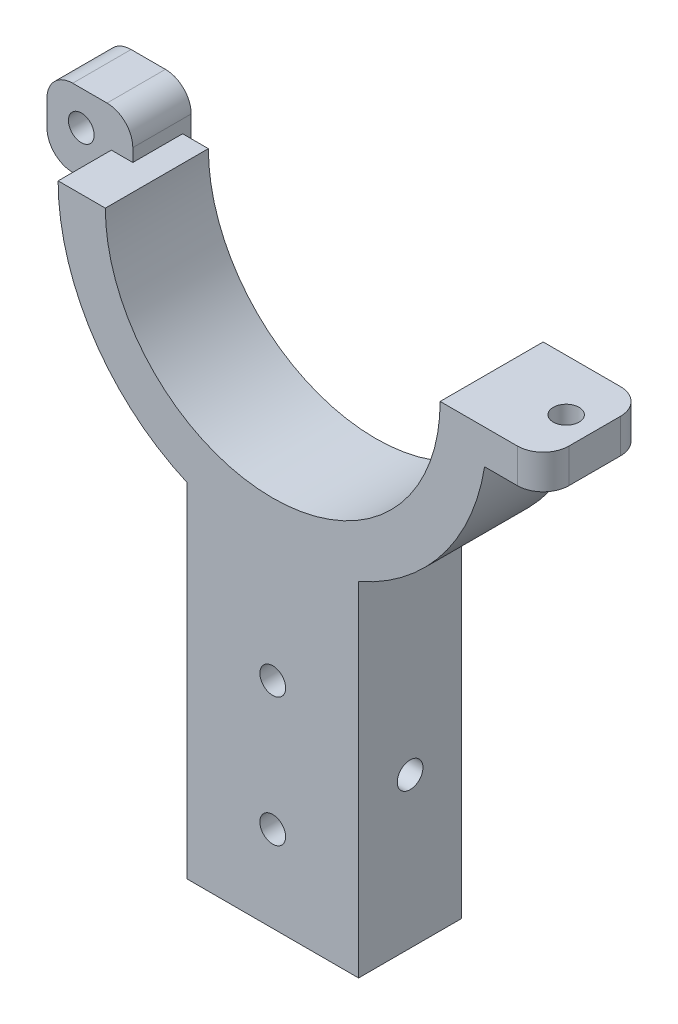
from build123d import *

# Parameters (mm, degrees)
BOSS_EXTRUDE8_DEPTH      = 12
BOSS_EXTRUDE9_DEPTH      = 1
BOSS_EXTRUDE9_DEPTH_BACK = 5.8
SKETCH2_W                = 10
SKETCH2_H                = 9
SKETCH3_R                = 1.5
CUT_EXTRUDE1_DEPTH       = 10
SKETCH4_W                = 8
SKETCH4_H                = 4
BOSS_EXTRUDE10_DEPTH     = 12
SKETCH5_R                = 1.5
CUT_EXTRUDE2_DEPTH       = 12
FILLET2_R                = 3
FILLET3_R                = 3
FILLET4_R                = 3
FILLET5_R                = 3
FILLET6_R                = 3
SKETCH6_R                = 1.5
CUT_EXTRUDE4_DEPTH       = 20
SKETCH7_R                = 1.5
CUT_EXTRUDE5_DEPTH       = 30


with BuildPart() as part:
    # Sketch1 → Boss-Extrude8 (new body)
    with BuildSketch(Plane.XY):
        with BuildLine():
            Line((25, 0), (19.5, 0))
            ThreePointArc((19.5, 0), (0, -19.5), (-19.5, 0))
            Line((-19.5, 0), (-25, 0))
            ThreePointArc((-25, 0), (-20.916500663, -13.693063938), (-10, -22.912878475))
            Line((-10, -22.912878475), (-10, -62.912878475))
            Line((-10, -62.912878475), (10, -62.912878475))
            Line((10, -62.912878475), (10, -22.912878475))
            ThreePointArc((10, -22.912878475), (20.916500663, -13.693063938), (25, 0))
        make_face()
    extrude(amount=BOSS_EXTRUDE8_DEPTH)

    # Sketch2 → Boss-Extrude9 (add, two sides: drawn at the far end of the back side and taken through both)
    with BuildSketch(Plane(origin=(0, 0, 0), x_dir=(-1, 0, 0), z_dir=(0, 0, -1)).offset(-BOSS_EXTRUDE9_DEPTH_BACK)):
        with Locations((27.5, 0)):
            Rectangle(SKETCH2_W, SKETCH2_H)
    extrude(amount=BOSS_EXTRUDE9_DEPTH + BOSS_EXTRUDE9_DEPTH_BACK)

    # Sketch3 → Cut-Extrude1 (cut)
    with BuildSketch(Plane(origin=(0, 0, -1), x_dir=(-1, 0, 0), z_dir=(0, 0, -1))):
        with Locations((28.5, 0.5)):
            Circle(SKETCH3_R)
    extrude(amount=-CUT_EXTRUDE1_DEPTH, mode=Mode.SUBTRACT)

    # Sketch4 → Boss-Extrude10 (add)
    with BuildSketch(Plane(origin=(0, 0, 0), x_dir=(-1, 0, 0), z_dir=(0, 0, -1))):
        with Locations((-27.5, -2)):
            Rectangle(SKETCH4_W, SKETCH4_H)
    extrude(amount=-BOSS_EXTRUDE10_DEPTH)

    # Sketch5 → Cut-Extrude2 (cut)
    with BuildSketch(Plane.XZ.offset(4)):
        with Locations((28.177925359, 6)):
            Circle(SKETCH5_R)
    extrude(amount=-CUT_EXTRUDE2_DEPTH, mode=Mode.SUBTRACT)

    # Fillet2
    fillet2_edges = [part.edges().sort_by_distance(p)[0] for p in [
        (-32.5, -4.5, 2.4),
    ]]
    fillet(fillet2_edges, radius=FILLET2_R)

    # Fillet3
    fillet3_edges = [part.edges().sort_by_distance(p)[0] for p in [
        (-32.5, 4.5, 2.4),
    ]]
    fillet(fillet3_edges, radius=FILLET3_R)

    # Fillet4
    fillet4_edges = [part.edges().sort_by_distance(p)[0] for p in [
        (-22.5, 4.5, 2.4),
    ]]
    fillet(fillet4_edges, radius=FILLET4_R)

    # Fillet5
    fillet5_edges = [part.edges().sort_by_distance(p)[0] for p in [
        (31.5, -2, 0),
    ]]
    fillet(fillet5_edges, radius=FILLET5_R)

    # Fillet6
    fillet6_edges = [part.edges().sort_by_distance(p)[0] for p in [
        (31.5, -2, 12),
    ]]
    fillet(fillet6_edges, radius=FILLET6_R)

    # Sketch6 → Cut-Extrude4 (cut)
    with BuildSketch(Plane(origin=(0, 0, 0), x_dir=(-1, 0, 0), z_dir=(0, 0, -1))):
        with Locations((0, -37.912878475)):
            Circle(SKETCH6_R)
        with Locations((0, -52.912878475)):
            Circle(SKETCH6_R)
    extrude(amount=-CUT_EXTRUDE4_DEPTH, mode=Mode.SUBTRACT)

    # Sketch7 → Cut-Extrude5 (cut)
    with BuildSketch(Plane(origin=(10, 0, 0), x_dir=(0, 0, -1), z_dir=(1, 0, 0))):
        with Locations((-6, -45.412878475)):
            Circle(SKETCH7_R)
    extrude(amount=-CUT_EXTRUDE5_DEPTH, mode=Mode.SUBTRACT)


solid = part.part
